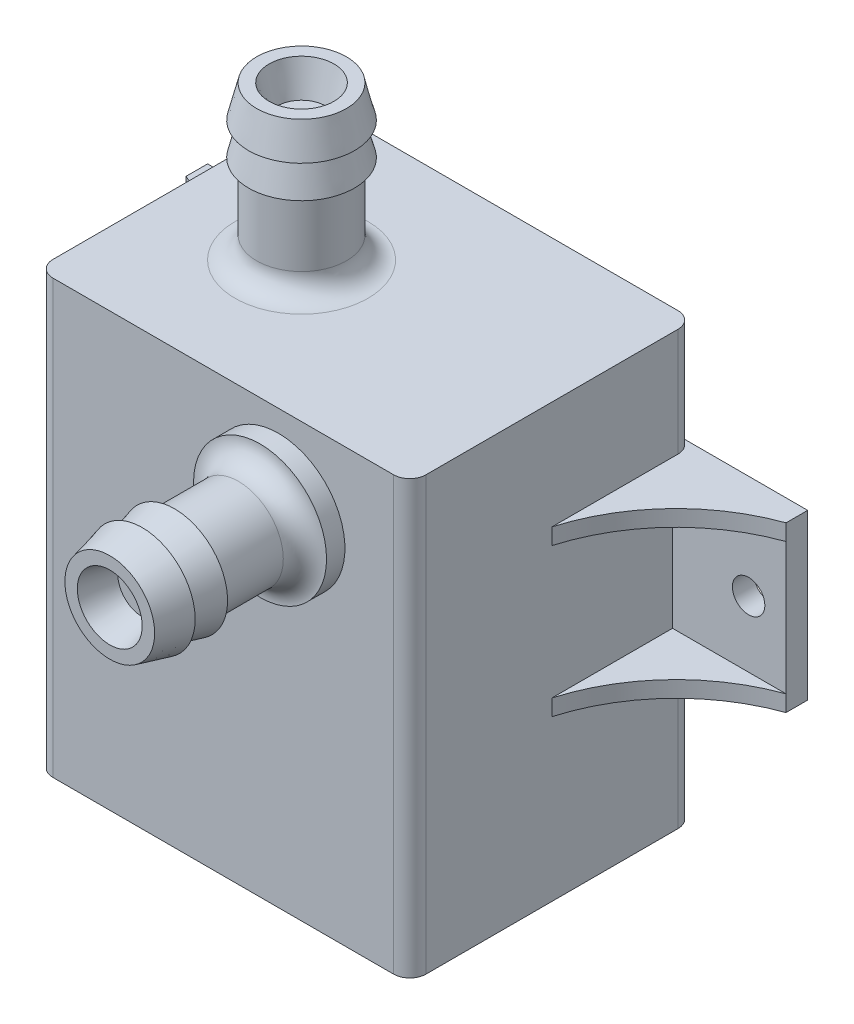
from build123d import *

# Parameters (mm, degrees)
SKETCH1_W            = 34.5
SKETCH1_H            = 40
BOSS_EXTRUDE1_DEPTH  = 26.3
FILLET1_R            = 1.5
SKETCH2_R            = 4.15
SKETCH2_R_2          = 3
BOSS_EXTRUDE2_DEPTH  = 14.2
SKETCH3_R            = 4.15
SKETCH3_R_2          = 3
BOSS_EXTRUDE3_DEPTH  = 3
BOSS_EXTRUDE3_DRAFT  = 14
SKETCH4_R            = 4.15
BOSS_EXTRUDE4_DEPTH  = 3
BOSS_EXTRUDE4_DRAFT  = -14
SKETCH5_R            = 4.15
SKETCH5_R_2          = 3
BOSS_EXTRUDE5_DEPTH  = 15.6
SKETCH6_R            = 6.15
BOSS_EXTRUDE6_DEPTH  = 1.7
FILLET2_R            = 2
SKETCH7_R            = 4.15
SKETCH7_R_2          = 3
BOSS_EXTRUDE7_DEPTH  = 3
BOSS_EXTRUDE7_DRAFT  = 14
SKETCH8_R            = 4.15
BOSS_EXTRUDE8_DEPTH  = 3
BOSS_EXTRUDE8_DRAFT  = -14
BOSS_EXTRUDE9_DEPTH  = 3
SKETCH10_W           = 10.5
SKETCH10_H           = 15.2
SKETCH10_R           = 1.5
BOSS_EXTRUDE10_DEPTH = 2
SKETCH11_W           = 1.5
SKETCH11_H           = 15.2
BOSS_EXTRUDE11_DEPTH = 36
BOSS_EXTRUDE12_DEPTH = 1.5
BOSS_EXTRUDE14_START = -1.5
BOSS_EXTRUDE14_DEPTH = 1.5


with BuildPart() as part:
    # Sketch1 → Boss-Extrude1 (new body)
    with BuildSketch(Plane.XY):
        Rectangle(SKETCH1_W, SKETCH1_H)
    extrude(amount=BOSS_EXTRUDE1_DEPTH)

    # Fillet1
    fillet1_edges = [part.edges().sort_by_distance(p)[0] for p in [
        (17.25, 0, 26.3),
        (-17.25, 0, 26.3),
        (17.25, 0, 0),
        (-17.25, 0, 0),
    ]]
    fillet(fillet1_edges, radius=FILLET1_R)

    # Sketch2 → Boss-Extrude2 (add)
    with BuildSketch(Plane(origin=(0, 20, 0), x_dir=(1, 0, 0), z_dir=(0, 1, 0))):
        with Locations(Location((-5.712581949, -13.35, 0), (0, 0, 270))):
            Circle(SKETCH2_R)
        with Locations(Location((-5.712581949, -13.35, 0), (0, 0, 270))):
            Circle(SKETCH2_R_2, mode=Mode.SUBTRACT)
    extrude(amount=BOSS_EXTRUDE2_DEPTH)


with BuildPart() as boss_extrude3_tool:
    # Sketch3 → Boss-Extrude3 (with draft: the straight prism first)
    with BuildSketch(Plane(origin=(0, 34.2, 0), x_dir=(1, 0, 0), z_dir=(0, 1, 0))):
        with Locations(Location((-5.712581949, -13.35, 0), (0, 0, 270))):
            Circle(SKETCH3_R)
        with Locations(Location((-5.712581949, -13.35, 0), (0, 0, 270))):
            Circle(SKETCH3_R_2, mode=Mode.SUBTRACT)
    extrude(amount=-BOSS_EXTRUDE3_DEPTH)
    # Boss-Extrude3: the draft: its side faces are tilted about the plane it starts from
    boss_extrude3_sides = [boss_extrude3_tool.faces().sort_by_distance(p)[0] for p in [
        (-5.712581949, 32.7, 9.2),
        (-5.712581949, 32.7, 10.35),
    ]]
    draft(boss_extrude3_sides, Plane(origin=(0, 34.2, 0), x_dir=(1, 0, 0), z_dir=(0, 1, 0)), BOSS_EXTRUDE3_DRAFT)


with BuildPart() as part_1:
    add(part.part)

    # Boss-Extrude3: add boss_extrude3_tool
    add(boss_extrude3_tool.part)


with BuildPart() as boss_extrude4_tool:
    # Sketch4 → Boss-Extrude4 (with draft: the straight prism first)
    with BuildSketch(Plane.XZ.offset(-31.2)):
        with Locations(Location((-5.712581949, 13.35, 0), (0, 0, 270))):
            Circle(SKETCH4_R)
    extrude(amount=BOSS_EXTRUDE4_DEPTH)
    # Boss-Extrude4: the draft: its side faces are tilted about the plane it starts from
    boss_extrude4_sides = [boss_extrude4_tool.faces().sort_by_distance(p)[0] for p in [
        (-5.712581949, 29.7, 17.5),
    ]]
    draft(boss_extrude4_sides, Plane.XZ.offset(-31.2), BOSS_EXTRUDE4_DRAFT)


with BuildPart() as part_2:
    add(part_1.part)

    # Boss-Extrude4: add boss_extrude4_tool
    add(boss_extrude4_tool.part)

    # Sketch5 → Boss-Extrude5 (add)
    with BuildSketch(Plane.XY.offset(26.3)):
        with Locations(Location((5.1, 11.85, 0), (0, 0, 180))):
            Circle(SKETCH5_R)
        with Locations((5.1, 11.85)):
            Circle(SKETCH5_R_2, mode=Mode.SUBTRACT)
    extrude(amount=BOSS_EXTRUDE5_DEPTH)

    # Sketch6 → Boss-Extrude6 (add)
    with BuildSketch(Plane.XY.offset(26.3)):
        with Locations(Location((5.1, 11.85, 0), (0, 0, 180))):
            Circle(SKETCH6_R)
    extrude(amount=BOSS_EXTRUDE6_DEPTH)

    # Fillet2
    fillet2_edges = [part_2.edges().sort_by_distance(p)[0] for p in [
        (-5.712581949, 20, 9.2),
        (9.25, 11.85, 28),
    ]]
    fillet(fillet2_edges, radius=FILLET2_R - 0.0001)  # a hair under: the kernel refuses the full size


with BuildPart() as boss_extrude7_tool:
    # Sketch7 → Boss-Extrude7 (with draft: the straight prism first)
    with BuildSketch(Plane.XY.offset(41.9)):
        with Locations((5.1, 11.85)):
            Circle(SKETCH7_R)
        with Locations((5.1, 11.85)):
            Circle(SKETCH7_R_2, mode=Mode.SUBTRACT)
    extrude(amount=-BOSS_EXTRUDE7_DEPTH)
    # Boss-Extrude7: the draft: its side faces are tilted about the plane it starts from
    boss_extrude7_sides = [boss_extrude7_tool.faces().sort_by_distance(p)[0] for p in [
        (0.95, 11.85, 40.4),
        (2.1, 11.85, 40.4),
    ]]
    draft(boss_extrude7_sides, Plane.XY.offset(41.9), BOSS_EXTRUDE7_DRAFT)


with BuildPart() as part_3:
    add(part_2.part)

    # Boss-Extrude7: add boss_extrude7_tool
    add(boss_extrude7_tool.part)


with BuildPart() as boss_extrude8_tool:
    # Sketch8 → Boss-Extrude8 (with draft: the straight prism first)
    with BuildSketch(Plane(origin=(0, 0, 38.9), x_dir=(-1, 0, 0), z_dir=(0, 0, -1))):
        with Locations((-5.1, 11.85)):
            Circle(SKETCH8_R)
    extrude(amount=BOSS_EXTRUDE8_DEPTH)
    # Boss-Extrude8: the draft: its side faces are tilted about the plane it starts from
    boss_extrude8_sides = [boss_extrude8_tool.faces().sort_by_distance(p)[0] for p in [
        (9.25, 11.85, 37.4),
    ]]
    draft(boss_extrude8_sides, Plane(origin=(0, 0, 38.9), x_dir=(-1, 0, 0), z_dir=(0, 0, -1)), BOSS_EXTRUDE8_DRAFT)


with BuildPart() as part_4:
    add(part_3.part)

    # Boss-Extrude8: add boss_extrude8_tool
    add(boss_extrude8_tool.part)

    # Sketch9 → Boss-Extrude9 (add)
    with BuildSketch(Plane.XZ.offset(20)):
        with BuildLine():
            Line((-13.4, 4.074600211), (-17.25, 4.074600211))
            Line((-17.25, 4.074600211), (-17.25, 8.374600211))
            Line((-17.25, 8.374600211), (-13.4, 8.374600211))
            ThreePointArc((-13.4, 8.374600211), (-11.25, 6.224600211), (-13.4, 4.074600211))
        make_face()
    extrude(amount=BOSS_EXTRUDE9_DEPTH)

    # Sketch10 → Boss-Extrude10 (add)
    # profile 1 of 2: a face of its own
    with BuildSketch(Plane(origin=(0, 0, 0), x_dir=(-1, 0, 0), z_dir=(0, 0, -1))):
        with Locations((22.5, 2.4)):
            Rectangle(SKETCH10_W, SKETCH10_H)
        with Locations((24.666201251, 2.4)):
            Circle(SKETCH10_R, mode=Mode.SUBTRACT)
    # profile 2 of 2: a face of its own
    with BuildSketch(Plane(origin=(0, 0, 0), x_dir=(-1, 0, 0), z_dir=(0, 0, -1))):
        with Locations((-22.5, 2.4)):
            Rectangle(SKETCH10_W, SKETCH10_H)
        with Locations((-24.285549997, 2.4)):
            Circle(SKETCH10_R, mode=Mode.SUBTRACT)
    extrude(amount=-BOSS_EXTRUDE10_DEPTH)

    # Sketch11 → Boss-Extrude11 (add)
    with BuildSketch(Plane(origin=(-17.25, 0, 0), x_dir=(0, 0, -1), z_dir=(1, 0, 0))):
        with Locations((-0.75, 2.4)):
            Rectangle(SKETCH11_W, SKETCH11_H)
    extrude(amount=BOSS_EXTRUDE11_DEPTH)

    # Sketch12 → Boss-Extrude12 (add)
    with BuildSketch(Plane.XZ.offset(5.2)):
        with BuildLine():
            Line((-17.25, 13.15), (-17.25, 2))
            Line((-17.25, 2), (-27.75, 2))
            ThreePointArc((-27.75, 2), (-21.157033541, 6.310323065), (-17.25, 13.15))
        make_face()
        with BuildLine():
            Line((17.25, 2), (27.75, 2))
            ThreePointArc((27.75, 2), (21.157033541, 6.310323065), (17.25, 13.15))
            Line((17.25, 13.15), (17.25, 2))
        make_face()
    extrude(amount=-BOSS_EXTRUDE12_DEPTH)

    # Sketch13 → Boss-Extrude14 (add)
    with BuildSketch(Plane(origin=(0, 10, 0), x_dir=(1, 0, 0), z_dir=(0, 1, 0)).offset(BOSS_EXTRUDE14_START)):
        with BuildLine():
            Line((-17.25, -13.15), (-17.25, -2))
            Line((-17.25, -2), (-27.75, -2))
            ThreePointArc((-27.75, -2), (-21.157033541, -6.310323065), (-17.25, -13.15))
        make_face()
        with BuildLine():
            Line((27.75, -2), (17.25, -2))
            Line((17.25, -2), (17.25, -13.15))
            ThreePointArc((17.25, -13.15), (21.157033541, -6.310323065), (27.75, -2))
        make_face()
    extrude(amount=BOSS_EXTRUDE14_DEPTH)


solid = part_4.part
